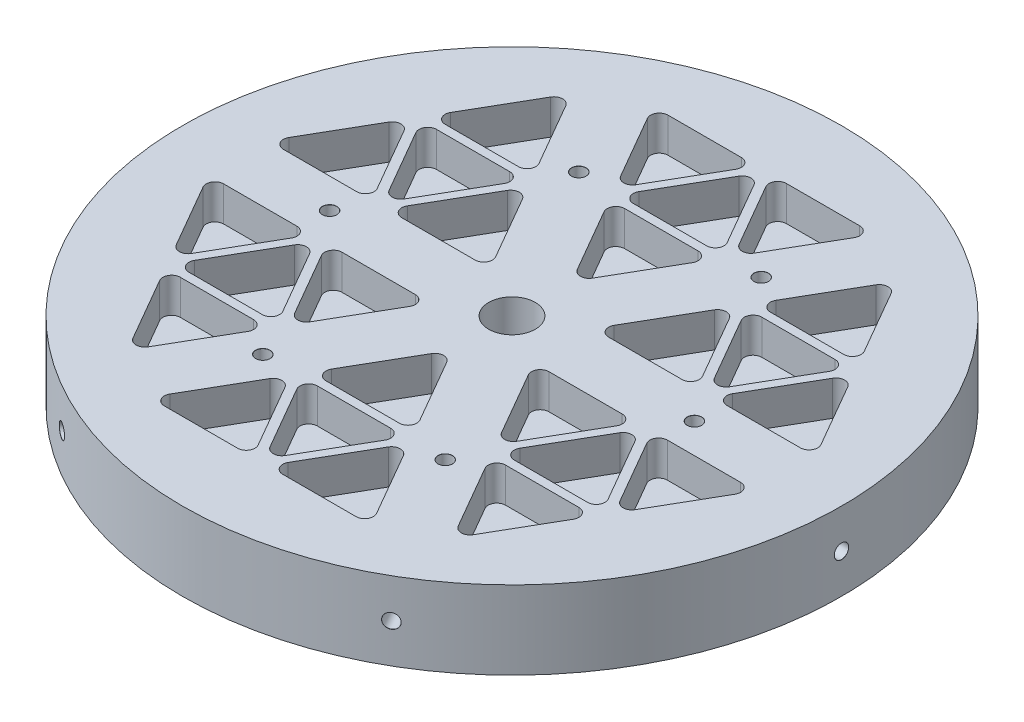
from build123d import *

# Parameters (mm, degrees)
SKETCH1_R              = 75.85000000000001
BASE_DEPTH             = 9
CENTER_THREADED_ROD_D  = 10.71626
CIRPATTERN1_COUNT      = 6
TRIANGULAR_SHAPE_DEPTH = 8
CIRPATTERN3_COUNT      = 6
FILLET1_R              = 2
CIRPATTERN4_COUNT      = 6


# Read off the part's stored shape, not the designer's step: Holes for avionics plates
with BuildPart() as part:
    # Sketch1 → Base (new, symmetric)
    with BuildSketch(Plane(origin=(0, 0, 0), x_dir=(1, 0, 0), z_dir=(0, 1, 0))):
        with Locations(Location((0, 0, 0), (0, 0, 270))):
            Circle(SKETCH1_R)
    extrude(amount=BASE_DEPTH, both=True)

    # Center threaded rod (through all)
    with Locations(Plane(origin=(0, 9, 0), x_dir=(1, 0, 0), z_dir=(0, 1, 0))):
        with Locations((0, 0)):
            Hole(CENTER_THREADED_ROD_D / 2)

    # Sketch8 → Radial Screws (revolve, cut)
    with BuildSketch(Plane(origin=(75.85, 0, 0), x_dir=(0, 0, -1), z_dir=(0, 1, 0))):
        Polygon((0, 0), (-6.6e-15, 30.991420021395474), (1.6499999999999866, 30), (1.64999999999999, 0.02097749077943634), (1.6749999999999994, -1.73e-15), align=None)
    radial_screws = revolve(axis=Axis((82.19999999999999, 0, 0), (-1, 0, 0)), mode=Mode.SUBTRACT)

    # CirPattern1: Radial Screws ×6 about axis
    cirpattern1_axis = Axis((0, 9, 0), (0, 1, 0))
    for i in range(1, CIRPATTERN1_COUNT):
        add(radial_screws.rotate(cirpattern1_axis, i * 360 / CIRPATTERN1_COUNT), mode=Mode.SUBTRACT)

    # Sketch10 → Triangular shape (cut)
    with BuildSketch(Plane(origin=(0, 9, 0), x_dir=(1, 0, 0), z_dir=(0, 1, 0))):
        Polygon((-25.523097577293367, -57.962594305340225), (-1.7320508075688785, -57.962594305340225), (-13.62757419243113, -37.358943420135105), align=None)
        Polygon((-2.6e-15, -13.755292534929985), (-11.895523384862246, -34.358943420135105), (11.895523384862242, -34.358943420135105), align=None)
        Polygon((13.627574192431124, -37.358943420135105), (1.7320508075688714, -57.96259430534023), (25.523097577293374, -57.962594305340225), align=None)
        Polygon((3.8e-16, -56.96259430534023), (-11.895523384862248, -36.358943420135105), (11.895523384862248, -36.358943420135105), align=None)
    triangular_shape = extrude(amount=-TRIANGULAR_SHAPE_DEPTH, mode=Mode.SUBTRACT)

    # CirPattern3: Triangular shape ×6 about axis
    cirpattern3_axis = Axis((1.06e-15, 0, -1.11e-15), (0, 1, 0))
    for i in range(1, CIRPATTERN3_COUNT):
        add(triangular_shape.rotate(cirpattern3_axis, i * 360 / CIRPATTERN3_COUNT), mode=Mode.SUBTRACT)

    # Fillet1
    fillet1_edges = [part.edges().sort_by_distance(p)[0] for p in [
        (-37.435530349029165, 5, -51.08494803787525),
        (-25.54000696416692, 5, -30.481297152670134),
        (-49.331053733891416, 5, -30.48129715267014),
        (8.71e-15, 5, -56.96259430534023),
        (11.895523384862255, 5, -36.358943420135105),
        (-11.89552338486224, 5, -36.358943420135105),
        (-25.52309757729336, 5, -57.962594305340225),
        (-1.732050807568862, 5, -57.96259430534023),
        (-13.627574192431116, 5, -37.358943420135105),
        (-11.895523384862235, 5, -34.358943420135105),
        (11.895523384862251, 5, -34.358943420135105),
        (8.65e-15, 5, -13.755292534929987),
        (-62.958627926322556, 5, 6.877646267465005),
        (-39.16758115659806, 5, 6.8776462674649945),
        (-51.06310454146031, 5, 27.48129715267012),
        (-49.33105373389142, 5, -28.481297152670145),
        (-25.540006964166924, 5, -28.48129715267013),
        (-37.43553034902918, 5, -7.877646267465017),
        (-62.95862792632255, 5, -6.877646267465027),
        (-51.0631045414603, 5, -27.48129715267015),
        (-39.16758115659806, 5, -6.8776462674650185),
        (-35.703479541460304, 5, -6.8776462674650185),
        (-23.80795615659805, 5, -27.481297152670127),
        (-11.91243277173581, 5, -6.877646267465006),
        (62.958627926322556, 5, -6.877646267464983),
        (39.16758115659807, 5, -6.877646267464985),
        (51.06310454146032, 5, -27.4812971526701),
        (49.33105373389144, 5, 28.481297152670123),
        (25.540006964166935, 5, 28.481297152670116),
        (37.435530349029186, 5, 7.877646267464996),
        (62.95862792632256, 5, 6.877646267465003),
        (51.06310454146031, 5, 27.481297152670127),
        (39.16758115659806, 5, 6.877646267464998),
        (35.703479541460304, 5, 6.877646267465003),
        (23.80795615659806, 5, 27.481297152670116),
        (11.912432771735814, 5, 6.877646267464999),
        (25.523097577293377, 5, -57.962594305340225),
        (13.627574192431133, 5, -37.358943420135105),
        (1.7320508075688876, 5, -57.962594305340225),
        (49.331053733891444, 5, -28.481297152670102),
        (37.435530349029186, 5, -7.877646267464985),
        (25.540006964166945, 5, -28.48129715267011),
        (37.4355303490292, 5, -51.08494803787522),
        (49.33105373389145, 5, -30.4812971526701),
        (25.54000696416695, 5, -30.481297152670106),
        (23.807956156598074, 5, -27.481297152670102),
        (35.70347954146031, 5, -6.8776462674649865),
        (11.91243277173582, 5, -6.8776462674649865),
        (-49.33105373389144, 5, 28.481297152670123),
        (-37.435530349029186, 5, 7.8776462674649945),
        (-25.540006964166935, 5, 28.481297152670116),
        (-37.43553034902918, 5, 51.084948037875236),
        (-49.331053733891444, 5, 30.48129715267012),
        (-25.540006964166935, 5, 30.481297152670116),
        (-23.807956156598063, 5, 27.48129715267011),
        (-35.70347954146031, 5, 6.877646267464996),
        (-11.912432771735816, 5, 6.877646267464988),
        (37.435530349029186, 5, 51.084948037875236),
        (25.540006964166935, 5, 30.481297152670116),
        (49.33105373389143, 5, 30.48129715267012),
        (11.89552338486224, 5, 34.358943420135105),
        (-11.895523384862246, 5, 34.358943420135105),
        (-4.85e-15, 5, 13.755292534929985),
        (25.52309757729337, 5, 57.962594305340225),
        (1.7320508075688714, 5, 57.96259430534023),
        (13.627574192431123, 5, 37.358943420135105),
        (3.8e-16, 5, 56.96259430534023),
        (-11.895523384862248, 5, 36.358943420135105),
        (11.895523384862248, 5, 36.358943420135105),
        (-25.523097577293367, 5, 57.962594305340225),
        (-13.627574192431126, 5, 37.358943420135105),
        (-1.7320508075688783, 5, 57.962594305340225),
    ]]
    fillet(fillet1_edges, radius=FILLET1_R)

    # Holes for avionics plates outline → Holes for avionics plates (revolve, cut)
    with BuildSketch(Plane(origin=(-20.991845771, 0, 36.35894342), x_dir=(1, 0, 0), z_dir=(0, 0, 1))):
        Polygon((0, 9), (0, 0.008579979), (1.65, 1), (1.65, 8.979022509), (1.675, 9), align=None)
    holes_for_avionics_plates = revolve(axis=Axis((-20.991845771, 0, 36.35894342), (0, 1, 0)), mode=Mode.SUBTRACT)

    # CirPattern4: Holes for avionics plates ×6 about axis
    cirpattern4_axis = Axis((4.395e-14, 0, 2.328e-14), (0, 1, 0))
    for i in range(1, CIRPATTERN4_COUNT):
        add(holes_for_avionics_plates.rotate(cirpattern4_axis, i * 360 / CIRPATTERN4_COUNT), mode=Mode.SUBTRACT)


solid = part.part
